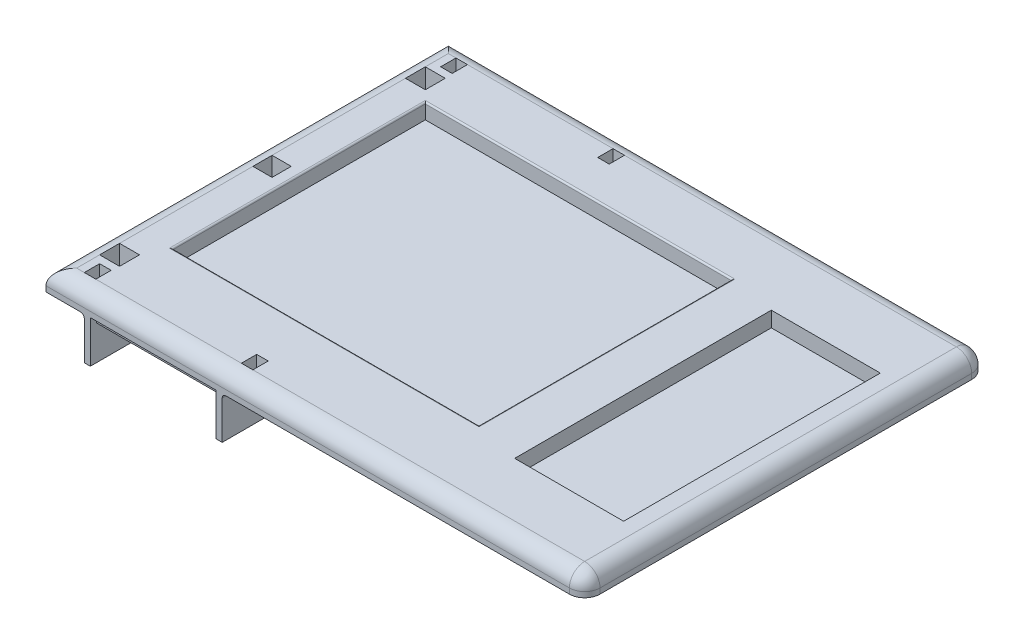
from build123d import *

# Parameters (mm, degrees)
SKETCH1_W             = 178.5874
SKETCH1_H             = 133.3754
BOSS_EXTRUDE1_DEPTH   = 6.858
FILLET1_R             = 5.08
FILLET2_R             = 5.08
SKETCH3_W             = 101.6
SKETCH3_H             = 83.82
CUT_EXTRUDE2_DEPTH    = 5.08
FILLET4_R             = 0.508
SKETCH5_W             = 45.72
SKETCH5_H             = 17.78
BOSS_EXTRUDE2_DEPTH   = 13.97
SKETCH7_W             = 41.720004
SKETCH7_H             = 13.78
CUT_EXTRUDE3_DEPTH    = 13.97
SKETCH9_W             = 21
SKETCH9_H             = 2.286
CUT_EXTRUDE4_DEPTH    = 2.762
SKETCH10_W            = 28
SKETCH10_H            = 13.97
CUT_EXTRUDE5_DEPTH    = 2.762
SKETCH11_W            = 41.720004
SKETCH11_H            = 13.78
BOSS_EXTRUDE3_DEPTH   = 2.54
MIRROR1_START         = -133.3754
MIRROR1_DEPTH         = 15.78
MIRROR1_2_DEPTH       = 2
MIRROR1_START_2       = -117.5954
MIRROR1_3_OUTLINE_W   = 15.720004
MIRROR1_3_OUTLINE_H   = 13.97
MIRROR1_3_OUTLINE_W_2 = 2
MIRROR1_3_DEPTH       = 2
SKETCH15_W            = 21
SKETCH15_H            = 11.684
CUT_EXTRUDE8_DEPTH    = 2.032
SKETCH17_W            = 20.720004
SKETCH17_H            = 13.97
CUT_EXTRUDE9_DEPTH    = 2.032
SKETCH22_W            = 6.35
SKETCH22_H            = 6.35
CUT_EXTRUDE12_DEPTH   = 7.62
FILLET6_R             = 1.27
FILLET7_R             = 1.27
SKETCH30_W            = 36.1188
SKETCH30_H            = 85.09
CUT_EXTRUDE14_DEPTH   = 5.08
SKETCH31_W            = 3.81
SKETCH31_H            = 5.08
CUT_EXTRUDE15_DEPTH   = 224.866617315
SKETCH32_W            = 3.81
SKETCH32_H            = 5.08
CUT_EXTRUDE16_DEPTH   = 224.866617315
SKETCH33_W            = 6.604
SKETCH33_H            = 6.604
CUT_EXTRUDE17_DEPTH   = 224.866617315


with BuildPart() as part:
    # Sketch1 → Boss-Extrude1 (new body)
    with BuildSketch(Plane(origin=(0, 0, 0), x_dir=(1, 0, 0), z_dir=(0, 1, 0))):
        with Locations((89.2937, 66.6877)):
            Rectangle(SKETCH1_W, SKETCH1_H)
    extrude(amount=BOSS_EXTRUDE1_DEPTH)

    # Fillet1
    fillet1_edges = [part.edges().sort_by_distance(p)[0] for p in [
        (178.5874, 6.858, -66.6877),
    ]]
    fillet(fillet1_edges, radius=FILLET1_R)

    # Fillet2
    fillet2_edges = [part.edges().sort_by_distance(p)[0] for p in [
        (86.7537, 6.858, -133.3754),
        (178.5874, 0.889, -133.3754),
        (177.099502448, 5.370102448, -133.3754),
        (178.5874, 0.889, 0),
        (177.099502448, 5.370102448, 0),
        (0, 6.858, -66.6877),
        (86.7537, 6.858, 0),
    ]]
    fillet(fillet2_edges, radius=FILLET2_R)

    # Sketch3 → Cut-Extrude2 (cut)
    with BuildSketch(Plane(origin=(0, 6.858, 0), x_dir=(1, 0, 0), z_dir=(0, 1, 0))):
        with Locations((66.04, 68.6054)):
            Rectangle(SKETCH3_W, SKETCH3_H)
    extrude(amount=-CUT_EXTRUDE2_DEPTH, mode=Mode.SUBTRACT)

    # Fillet4
    fillet4_edges = [part.edges().sort_by_distance(p)[0] for p in [
        (15.24, 6.858, -68.6054),
        (66.04, 6.858, -26.6954),
        (116.84, 6.858, -68.6054),
        (66.04, 6.858, -110.5154),
    ]]
    fillet(fillet4_edges, radius=FILLET4_R)

    # Sketch5 → Boss-Extrude2 (add)
    with BuildSketch(Plane.XZ):
        with Locations((35.56, -8.89)):
            Rectangle(SKETCH5_W, SKETCH5_H)
    extrude(amount=BOSS_EXTRUDE2_DEPTH)

    # Sketch7 → Cut-Extrude3 (cut)
    with BuildSketch(Plane.XZ.offset(13.97)):
        with Locations((35.559998, -8.89)):
            Rectangle(SKETCH7_W, SKETCH7_H)
    extrude(amount=-CUT_EXTRUDE3_DEPTH, mode=Mode.SUBTRACT)

    # Sketch9 → Cut-Extrude4 (cut)
    with BuildSketch(Plane.XY):
        with Locations((25.199996, -12.827)):
            Rectangle(SKETCH9_W, SKETCH9_H)
    extrude(amount=-CUT_EXTRUDE4_DEPTH, mode=Mode.SUBTRACT)

    # Sketch10 → Cut-Extrude5 (cut)
    with BuildSketch(Plane(origin=(0, 0, -17.78), x_dir=(-1, 0, 0), z_dir=(0, 0, -1))):
        with Locations((-42.420004, -6.985)):
            Rectangle(SKETCH10_W, SKETCH10_H)
    extrude(amount=-CUT_EXTRUDE5_DEPTH, mode=Mode.SUBTRACT)


with BuildPart() as boss_extrude3_tool:
    # Sketch11 → Boss-Extrude3 (new body)
    with BuildSketch(Plane.XZ):
        with Locations((35.559998, -8.89)):
            Rectangle(SKETCH11_W, SKETCH11_H)
    extrude(amount=BOSS_EXTRUDE3_DEPTH)


with BuildPart() as part_1:
    add(part.part)


with BuildPart() as part_2:
    # Boss-Extrude3: joined with boss_extrude3_tool
    add(part_1.part.fuse(boss_extrude3_tool.part, tol=0.00001))

    # Mirror1: read off the stored shape, not the designer's step
    # Mirror1 outline → Mirror1 (add)
    with BuildSketch(Plane.XY.offset(MIRROR1_START)):
        Polygon((12.7, -13.97), (14.699996, -13.97), (14.699996, -2.54), (56.42, -2.54), (56.42, -13.97), (58.42, -13.97), (58.42, 0), (12.7, 0), align=None)
    extrude(amount=MIRROR1_DEPTH)

    # Mirror1 2 outline → Mirror1 2 (add)
    with BuildSketch(Plane.XY.offset(MIRROR1_START)):
        Polygon((14.699996, -2.54), (14.699996, -11.684), (35.699996, -11.684), (35.699996, -13.97), (56.42, -13.97), (56.42, -2.54), align=None)
    extrude(amount=MIRROR1_2_DEPTH)

    # Mirror1 3 outline → Mirror1 3 (add)
    with BuildSketch(Plane.XY.offset(MIRROR1_START_2)):
        with Locations((20.560002, -6.985)):
            Rectangle(MIRROR1_3_OUTLINE_W, MIRROR1_3_OUTLINE_H)
        with Locations((57.42, -6.985)):
            Rectangle(MIRROR1_3_OUTLINE_W_2, MIRROR1_3_OUTLINE_H)
    extrude(amount=MIRROR1_3_DEPTH)

    # Sketch15 → Cut-Extrude8 (cut)
    with BuildSketch(Plane.XY):
        with Locations((25.199996, -5.842)):
            Rectangle(SKETCH15_W, SKETCH15_H)
    cut_extrude8 = extrude(amount=-CUT_EXTRUDE8_DEPTH, mode=Mode.SUBTRACT)

    # Sketch17 → Cut-Extrude9 (cut)
    with BuildSketch(Plane.XY):
        with Locations((46.059998, -6.985)):
            Rectangle(SKETCH17_W, SKETCH17_H)
    cut_extrude9 = extrude(amount=-CUT_EXTRUDE9_DEPTH, mode=Mode.SUBTRACT)

    # Mirror2: Cut-Extrude8, Cut-Extrude9 across plane
    add(cut_extrude8.mirror(Plane(origin=(0, 0, -66.6877), x_dir=(1, 0, 0), z_dir=(0, 0, -1))), mode=Mode.SUBTRACT)
    add(cut_extrude9.mirror(Plane(origin=(0, 0, -66.6877), x_dir=(1, 0, 0), z_dir=(0, 0, -1))), mode=Mode.SUBTRACT)

    # Sketch22 → Cut-Extrude12 (cut)
    with BuildSketch(Plane(origin=(0, 6.858, 0), x_dir=(1, 0, 0), z_dir=(0, 1, 0))):
        with Locations((8.255, 66.6877)):
            Rectangle(SKETCH22_W, SKETCH22_H)
    extrude(amount=-CUT_EXTRUDE12_DEPTH, mode=Mode.SUBTRACT)

    # Fillet6
    fillet6_edges = [part_2.edges().sort_by_distance(p)[0] for p in [
        (58.42, 0, -124.4854),
        (20.560002, 0, -115.5954),
        (12.7, 0, -124.4854),
        (57.42, 0, -115.5954),
    ]]
    fillet(fillet6_edges, radius=FILLET6_R)

    # Fillet7
    fillet7_edges = [part_2.edges().sort_by_distance(p)[0] for p in [
        (57.420002, 0, -17.78),
        (20.560002, 0, -17.78),
        (12.7, 0, -8.89),
        (58.42, 0, -8.89),
    ]]
    fillet(fillet7_edges, radius=FILLET7_R)

    # Sketch30 → Cut-Extrude14 (cut)
    with BuildSketch(Plane(origin=(0, 6.858, 0), x_dir=(1, 0, 0), z_dir=(0, 1, 0))):
        with Locations((150.368, 65.6082)):
            Rectangle(SKETCH30_W, SKETCH30_H)
    extrude(amount=-CUT_EXTRUDE14_DEPTH, mode=Mode.SUBTRACT)

    # Sketch31 → Cut-Extrude15 (cut, through all)
    with BuildSketch(Plane(origin=(0, 6.858, 0), x_dir=(1, 0, 0), z_dir=(0, 1, 0))):
        with Locations((9.525, 125.7554)):
            Rectangle(SKETCH31_W, SKETCH31_H)
    cut_extrude15 = extrude(amount=-CUT_EXTRUDE15_DEPTH, mode=Mode.SUBTRACT)

    # Sketch32 → Cut-Extrude16 (cut, through all)
    with BuildSketch(Plane(origin=(0, 6.858, 0), x_dir=(1, 0, 0), z_dir=(0, 1, 0))):
        with Locations((61.595, 125.7554)):
            Rectangle(SKETCH32_W, SKETCH32_H)
    cut_extrude16 = extrude(amount=-CUT_EXTRUDE16_DEPTH, mode=Mode.SUBTRACT)

    # Mirror3: Cut-Extrude15, Cut-Extrude16 across plane
    add(cut_extrude15.mirror(Plane(origin=(0, 0, -66.6877), x_dir=(1, 0, 0), z_dir=(0, 0, -1))), mode=Mode.SUBTRACT)
    add(cut_extrude16.mirror(Plane(origin=(0, 0, -66.6877), x_dir=(1, 0, 0), z_dir=(0, 0, -1))), mode=Mode.SUBTRACT)

    # Sketch33 → Cut-Extrude17 (cut, through all)
    with BuildSketch(Plane(origin=(0, 6.858, 0), x_dir=(1, 0, 0), z_dir=(0, 1, 0))):
        with Locations((8.382, 117.3734)):
            Rectangle(SKETCH33_W, SKETCH33_H)
    cut_extrude17 = extrude(amount=-CUT_EXTRUDE17_DEPTH, mode=Mode.SUBTRACT)

    # Mirror4: Cut-Extrude17 across plane
    add(cut_extrude17.mirror(Plane(origin=(0, 0, -66.6877), x_dir=(1, 0, 0), z_dir=(0, 0, -1))), mode=Mode.SUBTRACT)


solid = part_2.part
